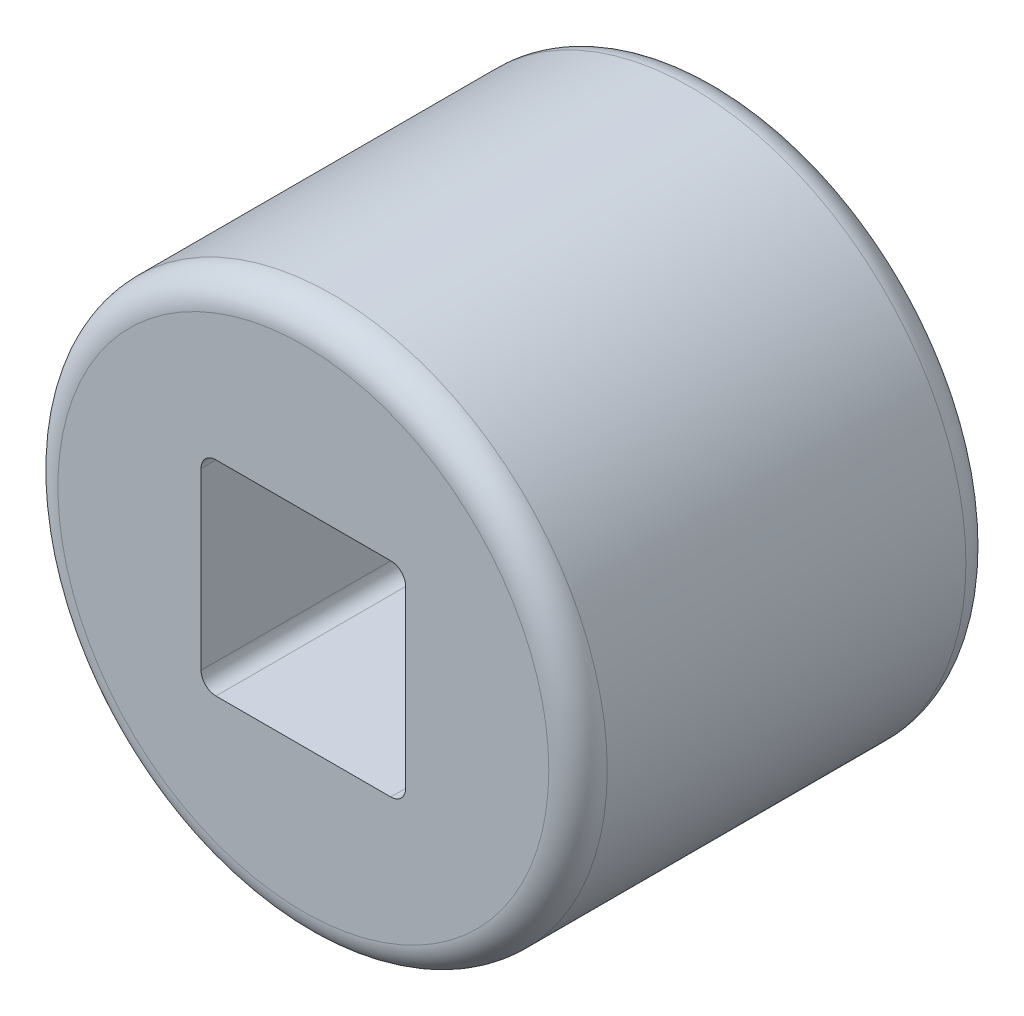
from build123d import *

# Parameters (mm, degrees)
SKETCH1_R           = 4.7
BOSS_EXTRUDE1_DEPTH = 7.1374
FILLET1_R           = 0.5


with BuildPart() as part:
    # Sketch1 → Boss-Extrude1 (new body)
    with BuildSketch(Plane.XY):
        Circle(SKETCH1_R)
        with BuildLine():
            Line((1.496, 1.75), (-1.496, 1.75))
            ThreePointArc((-1.496, 1.75), (-1.675605122, 1.675605122), (-1.75, 1.496))
            Line((-1.75, 1.496), (-1.75, -1.496))
            ThreePointArc((-1.75, -1.496), (-1.675605122, -1.675605122), (-1.496, -1.75))
            Line((-1.496, -1.75), (1.496, -1.75))
            ThreePointArc((1.496, -1.75), (1.675605122, -1.675605122), (1.75, -1.496))
            Line((1.75, -1.496), (1.75, 1.496))
            ThreePointArc((1.75, 1.496), (1.675605122, 1.675605122), (1.496, 1.75))
        make_face(mode=Mode.SUBTRACT)
    extrude(amount=BOSS_EXTRUDE1_DEPTH)

    # Fillet1
    fillet1_edges = [part.edges().sort_by_distance(p)[0] for p in [
        (-4.7, 0, 0),
        (-4.7, 0, 7.1374),
    ]]
    fillet(fillet1_edges, radius=FILLET1_R)


solid = part.part
